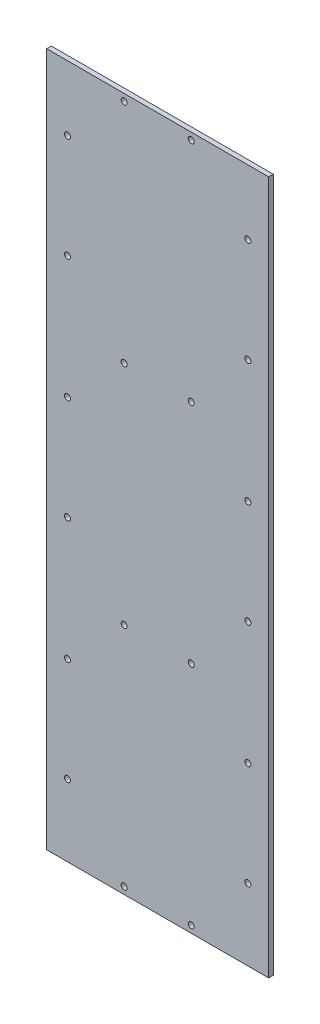
from build123d import *

# Parameters (mm, degrees)
SKETCH1_W           = 96
SKETCH1_H           = 300
BOSS_EXTRUDE1_DEPTH = 2
SKETCH2_R           = 1.3
CUT_EXTRUDE1_DEPTH  = 10


with BuildPart() as part:
    # Sketch1 → Boss-Extrude1 (new body)
    with BuildSketch(Plane.XY):
        Rectangle(SKETCH1_W, SKETCH1_H)
    extrude(amount=BOSS_EXTRUDE1_DEPTH)

    # Sketch2 → Cut-Extrude1 (cut)
    with BuildSketch(Plane.XY.offset(2)):
        with Locations((-39, 122)):
            Circle(SKETCH2_R)
        with Locations((-39, 77)):
            Circle(SKETCH2_R)
        with Locations((39, 122)):
            Circle(SKETCH2_R)
        with Locations((39, 77)):
            Circle(SKETCH2_R)
        with Locations((-39, 24)):
            Circle(SKETCH2_R)
        with Locations((-39, -21)):
            Circle(SKETCH2_R)
        with Locations((39, 24)):
            Circle(SKETCH2_R)
        with Locations((39, -21)):
            Circle(SKETCH2_R)
        with Locations((-39, -74)):
            Circle(SKETCH2_R)
        with Locations((-39, -119)):
            Circle(SKETCH2_R)
        with Locations((39, -74)):
            Circle(SKETCH2_R)
        with Locations((39, -119)):
            Circle(SKETCH2_R)
        with Locations((14.5, -147)):
            Circle(SKETCH2_R)
        with Locations((-14.5, -147)):
            Circle(SKETCH2_R)
        with Locations((-14.5, -49)):
            Circle(SKETCH2_R)
        with Locations((14.5, -49)):
            Circle(SKETCH2_R)
        with Locations((-14.5, 49)):
            Circle(SKETCH2_R)
        with Locations((14.5, 49)):
            Circle(SKETCH2_R)
        with Locations((-14.5, 147)):
            Circle(SKETCH2_R)
        with Locations((14.5, 147)):
            Circle(SKETCH2_R)
    extrude(amount=-CUT_EXTRUDE1_DEPTH, mode=Mode.SUBTRACT)


solid = part.part
